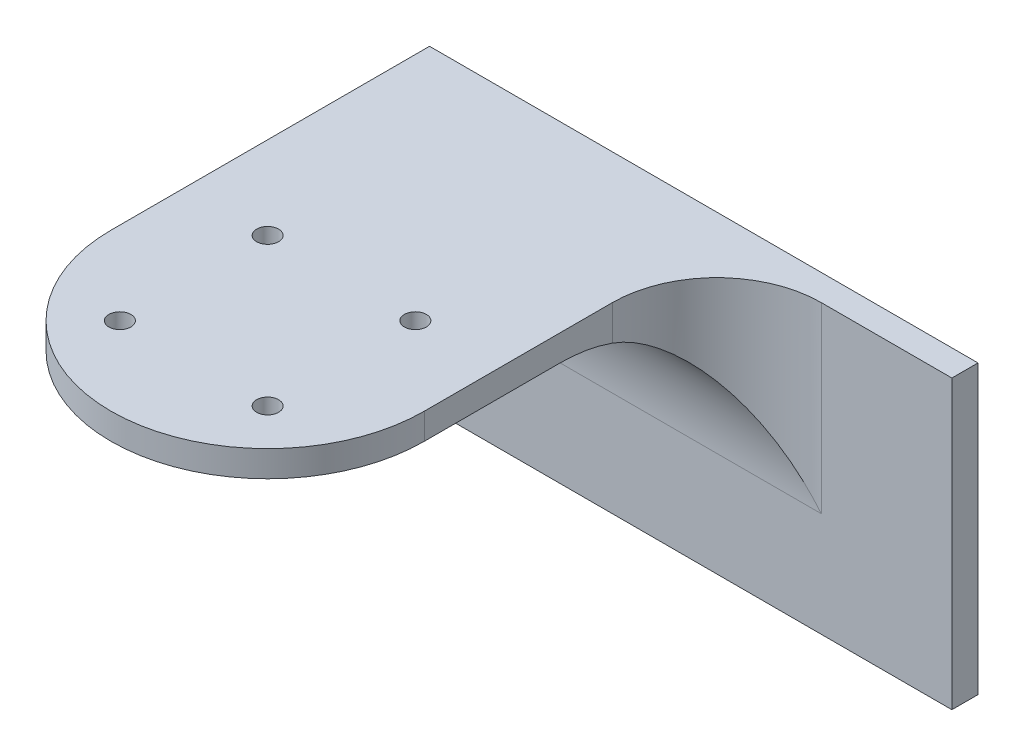
from build123d import *

# Parameters (mm, degrees)
SKETCH1_R           = 30
SKETCH1_R_2         = 2.1
BOSS_EXTRUDE1_DEPTH = 5
BOSS_EXTRUDE2_DEPTH = 5
SKETCH3_W           = 60
SKETCH3_H           = 5
BOSS_EXTRUDE3_DEPTH = 50
FILLET1_R           = 30
SKETCH4_W           = 5
SKETCH4_H           = 55
BOSS_EXTRUDE4_DEPTH = 45
FILLET2_R           = 20


with BuildPart() as part:
    # Sketch1 → Boss-Extrude1 (new body)
    with BuildSketch(Plane(origin=(0, 0, 0), x_dir=(1, 0, 0), z_dir=(0, 1, 0))):
        Circle(SKETCH1_R)
        with Locations((14.142135624, 14.142135624)):
            Circle(SKETCH1_R_2, mode=Mode.SUBTRACT)
        with Locations((-14.142135624, 14.142135624)):
            Circle(SKETCH1_R_2, mode=Mode.SUBTRACT)
        with Locations((-14.142135624, -14.142135624)):
            Circle(SKETCH1_R_2, mode=Mode.SUBTRACT)
        with Locations((14.142135624, -14.142135624)):
            Circle(SKETCH1_R_2, mode=Mode.SUBTRACT)
    extrude(amount=BOSS_EXTRUDE1_DEPTH)

    # Sketch2 → Boss-Extrude2 (add)
    with BuildSketch(Plane.XZ):
        with BuildLine():
            Line((-30, -61), (30, -61))
            Line((30, -61), (30, 0))
            ThreePointArc((30, 0), (0, -30), (-30, 0))
            Line((-30, 0), (-30, -61))
        make_face()
    extrude(amount=-BOSS_EXTRUDE2_DEPTH)

    # Sketch3 → Boss-Extrude3 (add)
    with BuildSketch(Plane.XZ):
        with Locations((0, -58.5)):
            Rectangle(SKETCH3_W, SKETCH3_H)
    extrude(amount=BOSS_EXTRUDE3_DEPTH)

    # Fillet1
    fillet1_edges = [part.edges().sort_by_distance(p)[0] for p in [
        (0, 0, -56),
    ]]
    fillet(fillet1_edges, radius=FILLET1_R)

    # Sketch4 → Boss-Extrude4 (add)
    with BuildSketch(Plane(origin=(30, 0, 0), x_dir=(0, 0, -1), z_dir=(1, 0, 0))):
        with Locations((58.5, -22.5)):
            Rectangle(SKETCH4_W, SKETCH4_H)
    extrude(amount=BOSS_EXTRUDE4_DEPTH)

    # Fillet2
    fillet2_edges = [part.edges().sort_by_distance(p)[0] for p in [
        (30, -12.5, -56),
    ]]
    fillet(fillet2_edges, radius=FILLET2_R)


solid = part.part
